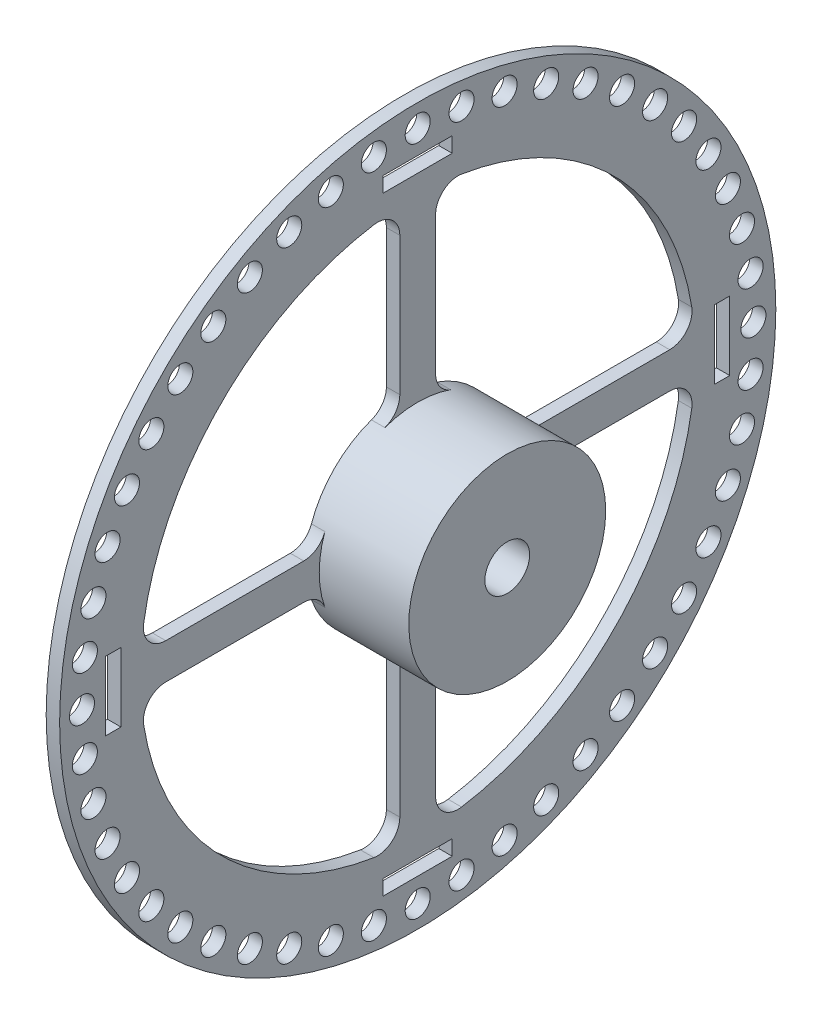
from build123d import *

# Parameters (mm, degrees)
SKETCH3_R           = 40
SKETCH3_R_2         = 3
SKETCH3_W           = 7.7
SKETCH3_H           = 1.7
SKETCH3_W_2         = 1.7
SKETCH3_H_2         = 7.7
BOSS_EXTRUDE2_DEPTH = 1.5
SKETCH4_R           = 1.4
CUT_EXTRUDE1_DEPTH  = 1.5
CIRPATTERN1_COUNT   = 48
FILLET1_R           = 2.5
SKETCH5_R           = 11
SKETCH5_R_2         = 2.5
BOSS_EXTRUDE4_DEPTH = 10


with BuildPart() as part:
    # Sketch3 → Boss-Extrude2 (new body)
    with BuildSketch(Plane(origin=(0, 0, 0), x_dir=(0, 0, -1), z_dir=(1, 0, 0))):
        Circle(SKETCH3_R)
        Circle(SKETCH3_R_2, mode=Mode.SUBTRACT)
        with BuildLine():
            Line((10.816653826, 2), (30.935416597, 2))
            ThreePointArc((30.935416597, 2), (21.920310217, 21.920310217), (2, 30.935416597))
            Line((2, 30.935416597), (2, 10.816653826))
            ThreePointArc((2, 10.816653826), (7.778174593, 7.778174593), (10.816653826, 2))
        make_face(mode=Mode.SUBTRACT)
        with BuildLine():
            Line((-30.935416597, 2), (-10.816653826, 2))
            ThreePointArc((-10.816653826, 2), (-7.778174593, 7.778174593), (-2, 10.816653826))
            Line((-2, 10.816653826), (-2, 30.935416597))
            ThreePointArc((-2, 30.935416597), (-21.920310217, 21.920310217), (-30.935416597, 2))
        make_face(mode=Mode.SUBTRACT)
        with BuildLine():
            Line((-30.935416597, -2), (-10.816653826, -2))
            ThreePointArc((-10.816653826, -2), (-7.778174593, -7.778174593), (-2, -10.816653826))
            Line((-2, -10.816653826), (-2, -30.935416597))
            ThreePointArc((-2, -30.935416597), (-21.920310217, -21.920310217), (-30.935416597, -2))
        make_face(mode=Mode.SUBTRACT)
        with BuildLine():
            Line((10.816653826, -2), (30.935416597, -2))
            ThreePointArc((30.935416597, -2), (21.920310217, -21.920310217), (2, -30.935416597))
            Line((2, -30.935416597), (2, -10.816653826))
            ThreePointArc((2, -10.816653826), (7.778174593, -7.778174593), (10.816653826, -2))
        make_face(mode=Mode.SUBTRACT)
        with Locations((0, 34)):
            Rectangle(SKETCH3_W, SKETCH3_H, mode=Mode.SUBTRACT)
        with Locations((34, 0)):
            Rectangle(SKETCH3_W_2, SKETCH3_H_2, mode=Mode.SUBTRACT)
        with Locations((0, -34)):
            Rectangle(SKETCH3_W, SKETCH3_H, mode=Mode.SUBTRACT)
        with Locations((-34, 0)):
            Rectangle(SKETCH3_W_2, SKETCH3_H_2, mode=Mode.SUBTRACT)
    extrude(amount=BOSS_EXTRUDE2_DEPTH)

    # Sketch4 → Cut-Extrude1 (cut)
    with BuildSketch(Plane.ZY):
        with Locations((0, 37.5)):
            Circle(SKETCH4_R)
    cut_extrude1 = extrude(amount=-CUT_EXTRUDE1_DEPTH, mode=Mode.SUBTRACT)

    # CirPattern1: Cut-Extrude1 ×48 about axis
    cirpattern1_axis = Axis((0, 0, 0), (1, 0, 0))
    for i in range(1, CIRPATTERN1_COUNT):
        add(cut_extrude1.rotate(cirpattern1_axis, i * 360 / CIRPATTERN1_COUNT), mode=Mode.SUBTRACT)

    # Fillet1
    fillet1_edges = [part.edges().sort_by_distance(p)[0] for p in [
        (0.75, -2, 30.935416597),
        (0.75, -30.935416597, 2),
        (0.75, -10.816653826, 2),
        (0.75, -2, 10.816653826),
        (0.75, -30.935416597, -2),
        (0.75, -2, -30.935416597),
        (0.75, 2, -10.816653826),
        (0.75, 2, -30.935416597),
        (0.75, 2, 10.816653826),
        (0.75, 2, 30.935416597),
        (0.75, 10.816653826, 2),
        (0.75, 30.935416597, 2),
        (0.75, 10.816653826, -2),
        (0.75, 30.935416597, -2),
        (0.75, -2, -10.816653826),
    ]]
    fillet(fillet1_edges, radius=FILLET1_R)

    # Sketch5 → Boss-Extrude4 (add)
    with BuildSketch(Plane(origin=(1.5, 0, 0), x_dir=(0, 0, -1), z_dir=(1, 0, 0))):
        Circle(SKETCH5_R)
        Circle(SKETCH5_R_2, mode=Mode.SUBTRACT)
    extrude(amount=BOSS_EXTRUDE4_DEPTH)


solid = part.part
